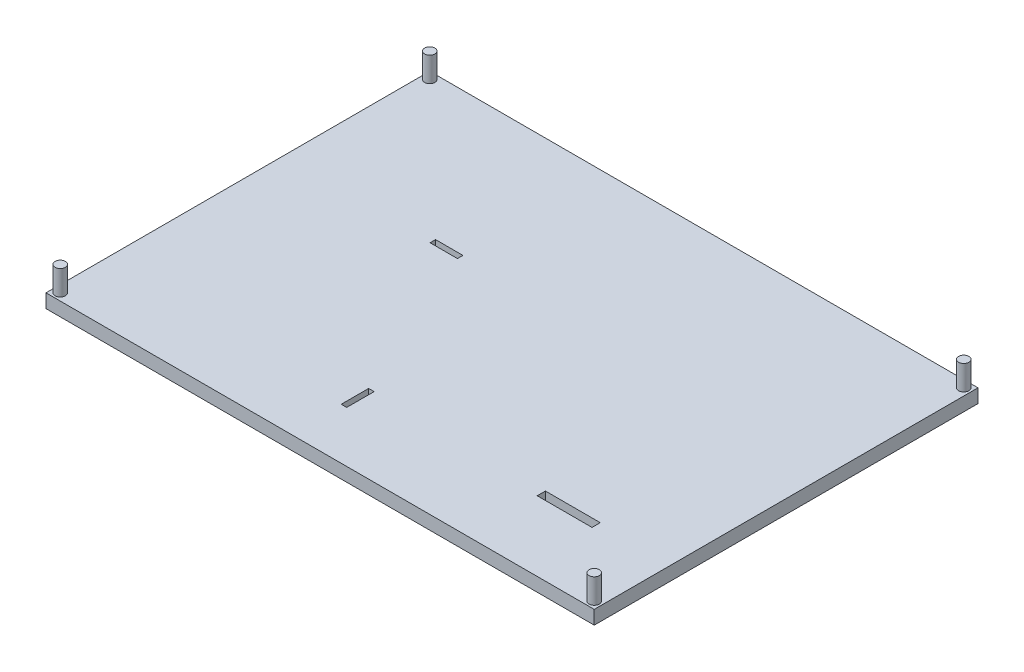
from build123d import *

# Parameters (mm, degrees)
SKETCH1_W           = 254
SKETCH1_H           = 177.8
BOSS_EXTRUDE1_DEPTH = 6.35
SKETCH2_R           = 2.38125
BOSS_EXTRUDE2_DEPTH = 11.43
SKETCH6_W           = 88.9
SKETCH6_H           = 44.45
SKETCH6_W_2         = 25.4
SKETCH6_H_2         = 3.81
SKETCH6_W_3         = 22.86
SKETCH6_H_3         = 33.02
CUT_EXTRUDE1_DEPTH  = 3.81
SKETCH7_W           = 25.4
SKETCH7_H           = 3.81
SKETCH7_W_2         = 2.54
SKETCH7_H_2         = 12.7
SKETCH7_W_3         = 12.7
SKETCH7_H_3         = 2.54
CUT_EXTRUDE2_DEPTH  = 156.651440405


with BuildPart() as part:
    # Sketch1 → Boss-Extrude1 (new body)
    with BuildSketch(Plane(origin=(0, 0, 0), x_dir=(1, 0, 0), z_dir=(0, 1, 0))):
        Rectangle(SKETCH1_W, SKETCH1_H)
    extrude(amount=BOSS_EXTRUDE1_DEPTH)

    # Sketch2 → Boss-Extrude2 (add)
    with BuildSketch(Plane(origin=(0, 6.35, 0), x_dir=(1, 0, 0), z_dir=(0, 1, 0))):
        with Locations((-123.698, -85.598)):
            Circle(SKETCH2_R)
        with Locations((-123.698, 85.598)):
            Circle(SKETCH2_R)
        with Locations((123.698, 85.598)):
            Circle(SKETCH2_R)
        with Locations((123.698, -85.598)):
            Circle(SKETCH2_R)
    extrude(amount=BOSS_EXTRUDE2_DEPTH)

    # Sketch6 → Cut-Extrude1 (cut)
    with BuildSketch(Plane.XZ):
        with Locations((-54.53997093, 44.251528595)):
            Rectangle(SKETCH6_W, SKETCH6_H)
        with Locations((80.905579206, 54.631113104)):
            Rectangle(SKETCH6_W_2, SKETCH6_H_2)
        with Locations((-51.784731879, -35.401836934)):
            Rectangle(SKETCH6_W_3, SKETCH6_H_3)
    extrude(amount=-CUT_EXTRUDE1_DEPTH, mode=Mode.SUBTRACT)

    # Sketch7 → Cut-Extrude2 (cut, through all)
    with BuildSketch(Plane(origin=(0, 3.81, 0), x_dir=(-1, 0, 0), z_dir=(0, -1, 0))):
        with Locations((-80.905579206, -54.631113104)):
            Rectangle(SKETCH7_W, SKETCH7_H)
        with Locations((12.62997093, -58.856528595)):
            Rectangle(SKETCH7_W_2, SKETCH7_H_2)
        with Locations((51.784731879, 21.431836934)):
            Rectangle(SKETCH7_W_3, SKETCH7_H_3)
    extrude(amount=-CUT_EXTRUDE2_DEPTH, mode=Mode.SUBTRACT)


solid = part.part
